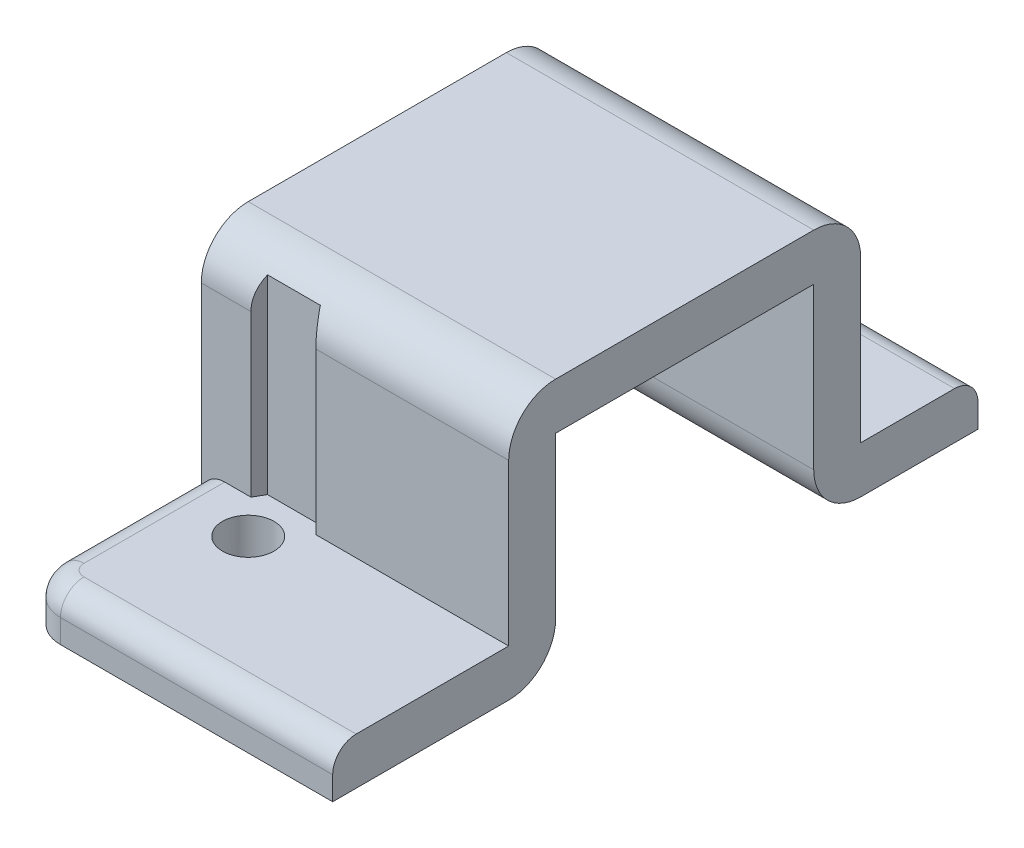
from build123d import *

# Parameters (mm, degrees)
BOSS_EXTRUDE1_DEPTH = 6.55
CUT_EXTRUDE1_REACH  = 20.607
SKETCH2_R           = 1.1
CUT_EXTRUDE2_REACH  = 20.607
FILLET1_R           = 2
FILLET3_R           = 1.5
FILLET4_R           = 1


with BuildPart() as part:
    # Sketch1 → Boss-Extrude1 (new, symmetric)
    with BuildSketch(Plane(origin=(0, 0, 0), x_dir=(0, 0, -1), z_dir=(1, 0, 0))):
        Polygon((-5.5, 8.85), (5.5, 8.85), (5.5, 0), (12.5, 0), (12.5, 2), (7.5, 2), (7.5, 10.85), (-7.5, 10.85), (-7.5, 2), (-15, 2), (-15, 0), (-5.5, 0), align=None)
    extrude(amount=BOSS_EXTRUDE1_DEPTH, both=True)

    # Sketch2 → Cut-Extrude1 (cut, up to next)
    with BuildSketch(Plane(origin=(0, 2, 0), x_dir=(1, 0, 0), z_dir=(0, 1, 0)), mode=Mode.PRIVATE) as cut_extrude1_sk1:
        with Locations(Location((-3.05, -9, 0), (0, 0, 270))):
            Circle(SKETCH2_R)
    cut_extrude1_tool1 = extrude(cut_extrude1_sk1.sketch, amount=-CUT_EXTRUDE1_REACH, mode=Mode.PRIVATE) & part.part
    cut_extrude1 = cut_extrude1_tool1.solids().sort_by_distance((-3.05, 2, 9))[0]
    add(cut_extrude1, mode=Mode.SUBTRACT)

    # Sketch3 → Cut-Extrude2 (cut, up to next)
    with BuildSketch(Plane(origin=(0, 2, 0), x_dir=(1, 0, 0), z_dir=(0, 1, 0)), mode=Mode.PRIVATE) as cut_extrude2_sk1:
        Polygon((-5.3, -9), (-4.175, -10.948557159), (-1.925, -10.948557159), (-0.8, -9), (-1.925, -7.051442841), (-4.175, -7.051442841), align=None)
    cut_extrude2_tool1 = extrude(cut_extrude2_sk1.sketch, amount=CUT_EXTRUDE2_REACH, mode=Mode.PRIVATE) & part.part
    cut_extrude2 = cut_extrude2_tool1.solids().sort_by_distance((-3.05, 2, 9))[0]
    add(cut_extrude2, mode=Mode.SUBTRACT)

    # Mirror1: Cut-Extrude1, Cut-Extrude2 across plane
    add(cut_extrude1.mirror(Plane.XY), mode=Mode.SUBTRACT)
    add(cut_extrude2.mirror(Plane.XY), mode=Mode.SUBTRACT)

    # Fillet1
    # the kernel refuses this fillet: 2 mm, written as the material it takes off along each edge
    with BuildSketch(Plane(origin=(-11.55, 0, -5.5), x_dir=(0, 1, 0), z_dir=(1, 0, 0)), Plane(origin=(11.55, 0, 5.5), x_dir=(0, 1, 0), z_dir=(-1, 0, 0))) as fillet1_piece_1:
        with BuildLine():
            CenterArc((FILLET1_R, -FILLET1_R), FILLET1_R, 90, 90)
            Line((0, -FILLET1_R), (0, 0))
            Line((0, 0), (FILLET1_R, 0))
        make_face()
    extrude(amount=23.1, mode=Mode.SUBTRACT)
    with BuildSketch(Plane(origin=(-6.666025404, 10.85, 7.5), x_dir=(0, 0, -1), z_dir=(1, 0, 0))) as fillet1_piece_2:
        with BuildLine():
            CenterArc((FILLET1_R, -FILLET1_R), FILLET1_R, 90, 90)
            Line((0, -FILLET1_R), (0, 0))
            Line((0, 0), (FILLET1_R, 0))
        make_face()
    extrude(amount=18.216025404, mode=Mode.SUBTRACT)
    with BuildSketch(Plane(origin=(-6.666025404, 10.85, -7.5), x_dir=(0, 0, 1), z_dir=(1, 0, 0))) as fillet1_piece_3:
        with BuildLine():
            CenterArc((FILLET1_R, FILLET1_R), FILLET1_R, 180, 90)
            Line((0, FILLET1_R), (0, 0))
            Line((0, 0), (FILLET1_R, 0))
        make_face()
    extrude(amount=18.216025404, mode=Mode.SUBTRACT)

    # Fillet3
    fillet3_edges = [part.edges().sort_by_distance(p)[0] for p in [
        (-6.55, 1, -12.5),
        (-6.55, 1, 15),
    ]]
    fillet(fillet3_edges, radius=FILLET3_R)

    # Fillet4
    fillet4_edges = [part.edges().sort_by_distance(p)[0] for p in [
        (-6.110660172, 2, 14.560660172),
        (-6.110660172, 2, -12.060660172),
        (-6.55, 2, 10.5),
        (-6.55, 2, -9.25),
        (0.75, 2, -12.5),
        (0.75, 2, 15),
    ]]
    fillet(fillet4_edges, radius=FILLET4_R)


solid = part.part
